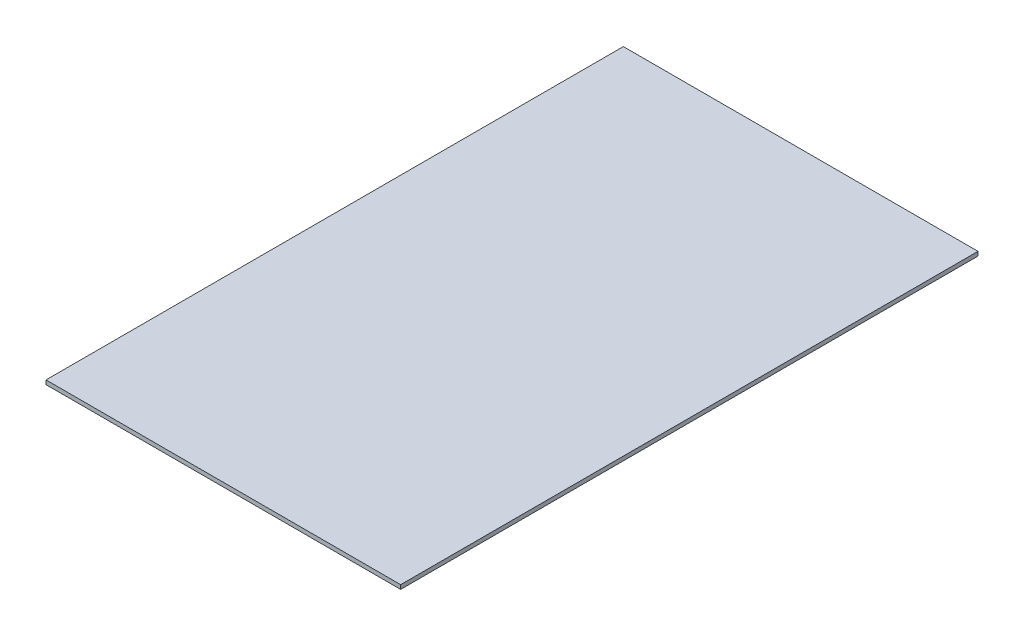
from build123d import *

# Parameters (mm, degrees)
SKETCH1_W           = 86
SKETCH1_H           = 140
BOSS_EXTRUDE1_DEPTH = 1


with BuildPart() as part:
    # Sketch1 → Boss-Extrude1 (new body)
    with BuildSketch(Plane(origin=(0, 0, 0), x_dir=(1, 0, 0), z_dir=(0, 1, 0))):
        with Locations((43, 70)):
            Rectangle(SKETCH1_W, SKETCH1_H)
    extrude(amount=BOSS_EXTRUDE1_DEPTH)


solid = part.part
